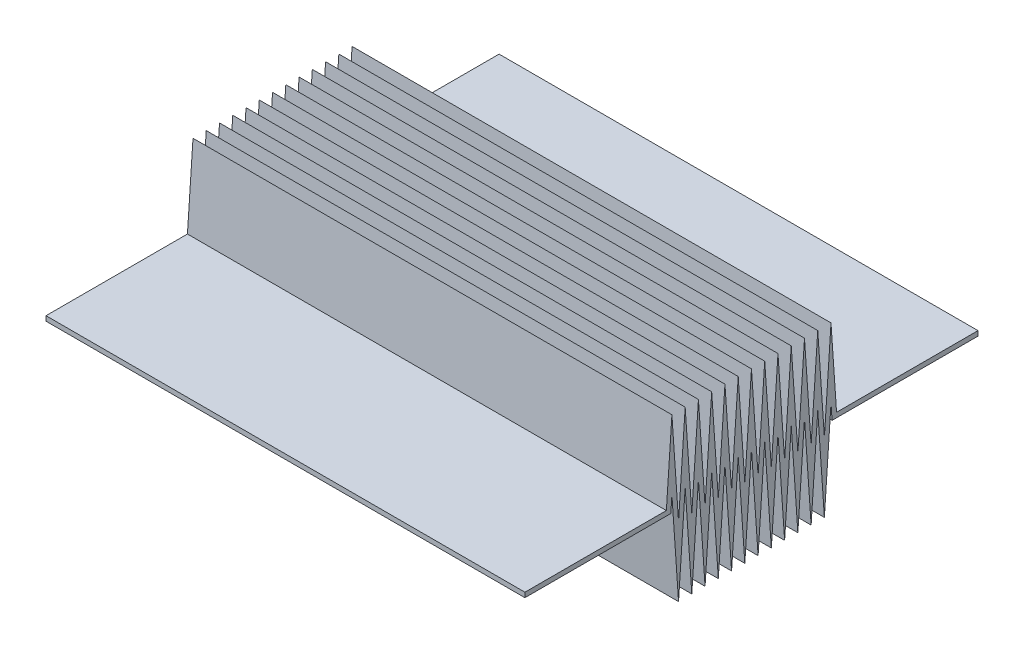
from build123d import *

# Parameters (mm, degrees)
EXTRUDE_THIN1_DEPTH = 25


with BuildPart() as part:
    # Sketch3 → Extrude-Thin1 (new, symmetric)
    with BuildSketch(Plane(origin=(0, 0, 0), x_dir=(0, 0, -1), z_dir=(1, 0, 0))):
        Polygon((0, 4.75), (15.233295794, 4.75), (15.346044485, 6.379106883), (16.038133455, -3.620893117), (16.730222424, 6.379106883), (17.422311394, -3.620893117), (18.114400364, 6.379106883), (18.806489334, -3.620893117), (19.498578303, 6.379106883), (20.190667273, -3.620893117), (20.882756243, 6.379106883), (21.574845213, -3.620893117), (22.266934182, 6.379106883), (22.959023152, -3.620893117), (23.651112122, 6.379106883), (24.343201092, -3.620893117), (25.035290062, 6.379106883), (25.727379031, -3.620893117), (26.419468001, 6.379106883), (27.111556971, -3.620893117), (27.803645941, 6.379106883), (28.49573491, -3.620893117), (29.18782388, 6.379106883), (29.87991285, -3.620893117), (30.57200182, 6.379106883), (31.264090789, -3.620893117), (31.956179759, 6.379106883), (32.06892845, 4.75), (47.302224244, 4.75), (47.302224244, 5.25), (32.535520038, 5.25), (31.956179759, 13.620893117), (31.264090789, 3.620893117), (30.57200182, 13.620893117), (29.87991285, 3.620893117), (29.18782388, 13.620893117), (28.49573491, 3.620893117), (27.803645941, 13.620893117), (27.111556971, 3.620893117), (26.419468001, 13.620893117), (25.727379031, 3.620893117), (25.035290062, 13.620893117), (24.343201092, 3.620893117), (23.651112122, 13.620893117), (22.959023152, 3.620893117), (22.266934182, 13.620893117), (21.574845213, 3.620893117), (20.882756243, 13.620893117), (20.190667273, 3.620893117), (19.498578303, 13.620893117), (18.806489334, 3.620893117), (18.114400364, 13.620893117), (17.422311394, 3.620893117), (16.730222424, 13.620893117), (16.038133455, 3.620893117), (15.346044485, 13.620893117), (14.766704206, 5.25), (0, 5.25), align=None)
    extrude(amount=EXTRUDE_THIN1_DEPTH, both=True)


solid = part.part
